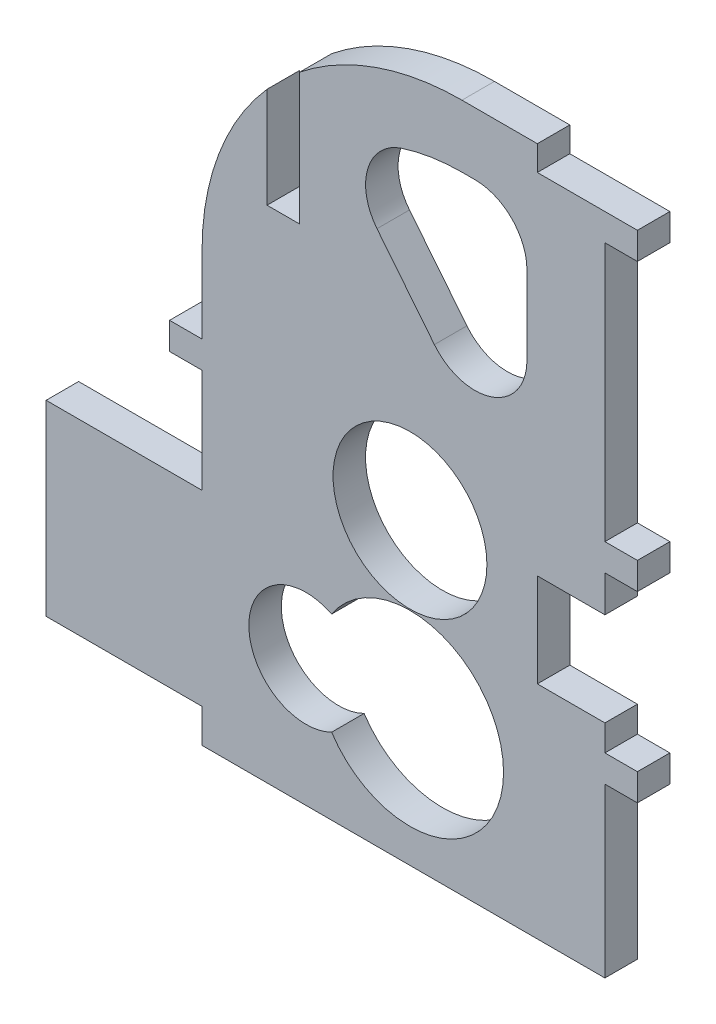
from build123d import *

# Parameters (mm, degrees)
SKETCH1_R           = 3.7592
BOSS_EXTRUDE1_DEPTH = 1.5875
CUT_EXTRUDE1_REACH  = 28.107
SKETCH2_W           = 3.302
SKETCH2_H           = 4.572
SKETCH2_H_2         = 1.2192
CUT_EXTRUDE2_DEPTH  = 27.106532827
CUT_EXTRUDE3_DEPTH  = 27.106532827


with BuildPart() as part:
    # Sketch1 → Boss-Extrude1 (new body)
    with BuildSketch(Plane.XY):
        with BuildLine():
            Line((11.112499999, 17.8308), (9.524999999, 17.8308))
            Line((9.524999999, 17.8308), (9.524999999, 19.05))
            Line((9.524999999, 19.05), (2.54, 19.05))
            ThreePointArc((2.54, 19.05), (-6.440256121, 15.330256121), (-10.16, 6.35))
            Line((-10.16, 6.35), (-10.16, 2.5908))
            Line((-10.160000001, 2.5908), (-11.747500001, 2.5908))
            Line((-11.747500001, 2.5908), (-11.747500001, 1.27))
            Line((-11.747500001, 1.27), (-10.160000001, 1.27))
            Line((-10.160000001, 1.27), (-10.160000001, -3.81))
            Line((-10.160000001, -3.81), (-17.78, -3.81))
            Line((-17.78, -3.81), (-17.78, -12.954))
            Line((-17.78, -12.954), (-10.16, -12.954))
            Line((-10.160000001, -12.954), (-10.160000001, -14.605))
            Line((-10.160000001, -14.605), (9.524999999, -14.605))
            Line((9.524999999, -14.605), (9.524999999, -6.4008))
            Line((9.524999999, -6.4008), (11.112499999, -6.4008))
            Line((11.112499999, -6.4008), (11.112499999, -5.08))
            Line((11.112499999, -5.08), (9.524999999, -5.08))
            Line((9.524999999, -5.08), (9.524999999, 2.54))
            Line((9.525, 2.54), (11.1125, 2.54))
            Line((11.1125, 2.54), (11.1125, 3.8608))
            Line((11.1125, 3.8608), (9.525, 3.8608))
            Line((9.524999999, 3.8608), (9.524999999, 16.51))
            Line((9.524999999, 16.51), (11.112499999, 16.51))
            Line((11.112499999, 16.51), (11.112499999, 17.8308))
        make_face()
        Circle(SKETCH1_R, mode=Mode.SUBTRACT)
        with BuildLine():
            ThreePointArc((-3.82905, -5.883688551), (4.572, -8.382), (-3.82905, -10.880311449))
            ThreePointArc((-3.82905, -10.880311449), (-7.874, -8.382), (-3.82905, -5.883688551))
        make_face(mode=Mode.SUBTRACT)
    extrude(amount=BOSS_EXTRUDE1_DEPTH)

    # Sketch2 → Cut-Extrude1 (cut, up to next)
    with BuildSketch(Plane.XY.offset(1.5875), mode=Mode.PRIVATE) as cut_extrude1_sk1:
        with Locations((7.873999999, -1.524)):
            Rectangle(SKETCH2_W, SKETCH2_H)
    cut_extrude1_tool1 = extrude(cut_extrude1_sk1.sketch, amount=-CUT_EXTRUDE1_REACH, mode=Mode.PRIVATE) & part.part
    # Sketch2 → Cut-Extrude1 (cut, up to next)
    with BuildSketch(Plane.XY.offset(1.5875), mode=Mode.PRIVATE) as cut_extrude1_sk2:
        with Locations((7.873999999, 18.4404)):
            Rectangle(SKETCH2_W, SKETCH2_H_2)
    cut_extrude1_tool2 = extrude(cut_extrude1_sk2.sketch, amount=-CUT_EXTRUDE1_REACH, mode=Mode.PRIVATE) & part.part
    add(cut_extrude1_tool1.solids().sort_by_distance((7.874, -1.524, 1.5875))[0], mode=Mode.SUBTRACT)
    add(cut_extrude1_tool2.solids().sort_by_distance((7.874, 18.4404, 1.5875))[0], mode=Mode.SUBTRACT)

    # Sketch3 → Cut-Extrude2 (cut, through all)
    with BuildSketch(Plane.XY.offset(1.5875)):
        Polygon((-5.3975, 9.8425), (-6.985, 9.8425), (-6.985, 14.750260413), (-6.985, 16.263934322), (-5.3975, 16.263934322), align=None)
    extrude(amount=-CUT_EXTRUDE2_DEPTH, mode=Mode.SUBTRACT)

    # Sketch4 → Cut-Extrude3 (cut, through all)
    with BuildSketch(Plane.XY.offset(1.5875)):
        with BuildLine():
            Line((3.175, 16.002), (2.54, 16.002))
            ThreePointArc((2.54, 16.002), (1.050284176, 15.886343679), (-0.403730229, 15.542146449))
            ThreePointArc((-0.403730229, 15.542146449), (-2.060909091, 13.856462185), (-1.611851244, 11.535660541))
            Line((-1.611851244, 11.535660541), (1.192213136, 8.033385254))
            ThreePointArc((1.192213136, 8.033385254), (4.016225702, 7.224233565), (5.715, 9.620885254))
            Line((5.715, 9.620885254), (5.715, 13.462))
            ThreePointArc((5.715, 13.462), (4.971051224, 15.258051224), (3.175, 16.002))
        make_face()
    extrude(amount=-CUT_EXTRUDE3_DEPTH, mode=Mode.SUBTRACT)


solid = part.part
